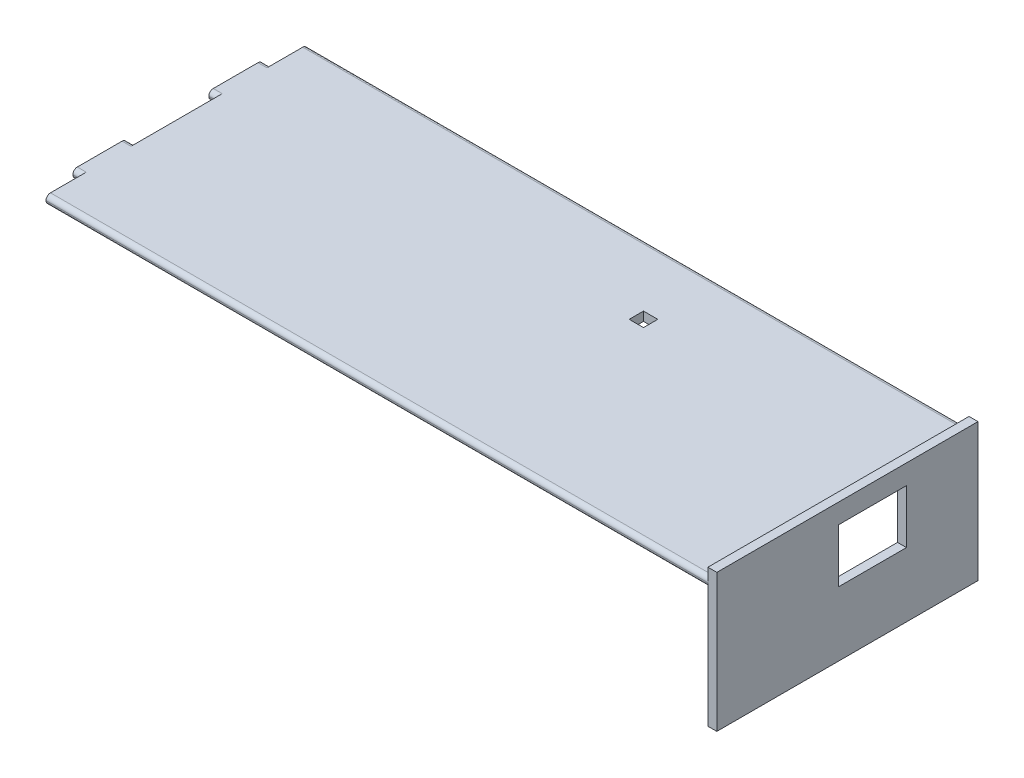
from build123d import *

# Parameters (mm, degrees)
SKETCH_1_W          = 185
SKETCH_1_H          = 73
EXTRUDE_1_DEPTH     = 2.5
SKETCH_2_W          = 15
SKETCH_2_H          = 2.5
EXTRUDE_2_DEPTH     = 2.5
FILLET_2_R          = 1.25
SKETCH_3_W          = 73
SKETCH_3_H          = 38.5
EXTRUDE_3_DEPTH     = 2.5
FILLET_3_R          = 1.25
SKETCH_4_W          = 19
SKETCH_4_H          = 15
CUT_EXTRUDE_1_DEPTH = 2.5
SKETCH_5_W          = 4
SKETCH_5_H          = 4
CUT_EXTRUDE_2_DEPTH = 2.5


with BuildPart() as part:
    # 草图1 → 凸台-拉伸1 (new body)
    with BuildSketch(Plane(origin=(0, 0, 0), x_dir=(1, 0, 0), z_dir=(0, 1, 0))):
        with Locations((5.493520518, 7.607451404)):
            Rectangle(SKETCH_1_W, SKETCH_1_H)
    extrude(amount=EXTRUDE_1_DEPTH)

    # 草图2 → 凸台-拉伸2 (add)
    with BuildSketch(Plane.ZY.offset(87.006479482)):
        with Locations((-26.607451404, 1.25)):
            Rectangle(SKETCH_2_W, SKETCH_2_H)
        with Locations((11.392548596, 1.25)):
            Rectangle(SKETCH_2_W, SKETCH_2_H)
    extrude(amount=EXTRUDE_2_DEPTH)

    # 圆角2
    fillet_2_edges = [part.edges().sort_by_distance(p)[0] for p in [
        (-88.256479482, 2.5, 3.892548596),
        (-88.256479482, 0, 3.892548596),
        (-88.256479482, 0, 18.892548596),
        (-88.256479482, 2.5, 18.892548596),
        (-88.256479482, 0, -34.107451404),
        (-88.256479482, 2.5, -19.107451404),
        (-88.256479482, 0, -19.107451404),
        (-88.256479482, 2.5, -34.107451404),
    ]]
    fillet(fillet_2_edges, radius=FILLET_2_R - 0.0001)  # a hair under: the kernel refuses the full size

    # 草图3 → 凸台-拉伸3 (add)
    with BuildSketch(Plane(origin=(97.993520518, 0, 0), x_dir=(0, 0, -1), z_dir=(1, 0, 0))):
        with Locations((7.607451404, -14.25)):
            Rectangle(SKETCH_3_W, SKETCH_3_H)
    extrude(amount=EXTRUDE_3_DEPTH)

    # 圆角3
    fillet_3_edges = [part.edges().sort_by_distance(p)[0] for p in [
        (5.493520518, 0, -44.107451404),
        (5.493520518, 2.5, -44.107451404),
        (5.493520518, 0, 28.892548596),
        (5.493520518, 2.5, 28.892548596),
    ]]
    fillet(fillet_3_edges, radius=FILLET_3_R - 0.0001)  # a hair under: the kernel refuses the full size

    # 草图4 → 切除-拉伸1 (cut)
    with BuildSketch(Plane(origin=(100.493520518, 0, 0), x_dir=(0, 0, -1), z_dir=(1, 0, 0))):
        with Locations((14.607451404, -8)):
            Rectangle(SKETCH_4_W, SKETCH_4_H)
    extrude(amount=-CUT_EXTRUDE_1_DEPTH, mode=Mode.SUBTRACT)

    # 草图5 → 切除-拉伸2 (cut)
    with BuildSketch(Plane(origin=(0, 2.5, 0), x_dir=(1, 0, 0), z_dir=(0, 1, 0))):
        with Locations((26.493520518, 24.607451404)):
            Rectangle(SKETCH_5_W, SKETCH_5_H)
    extrude(amount=-CUT_EXTRUDE_2_DEPTH, mode=Mode.SUBTRACT)


solid = part.part
